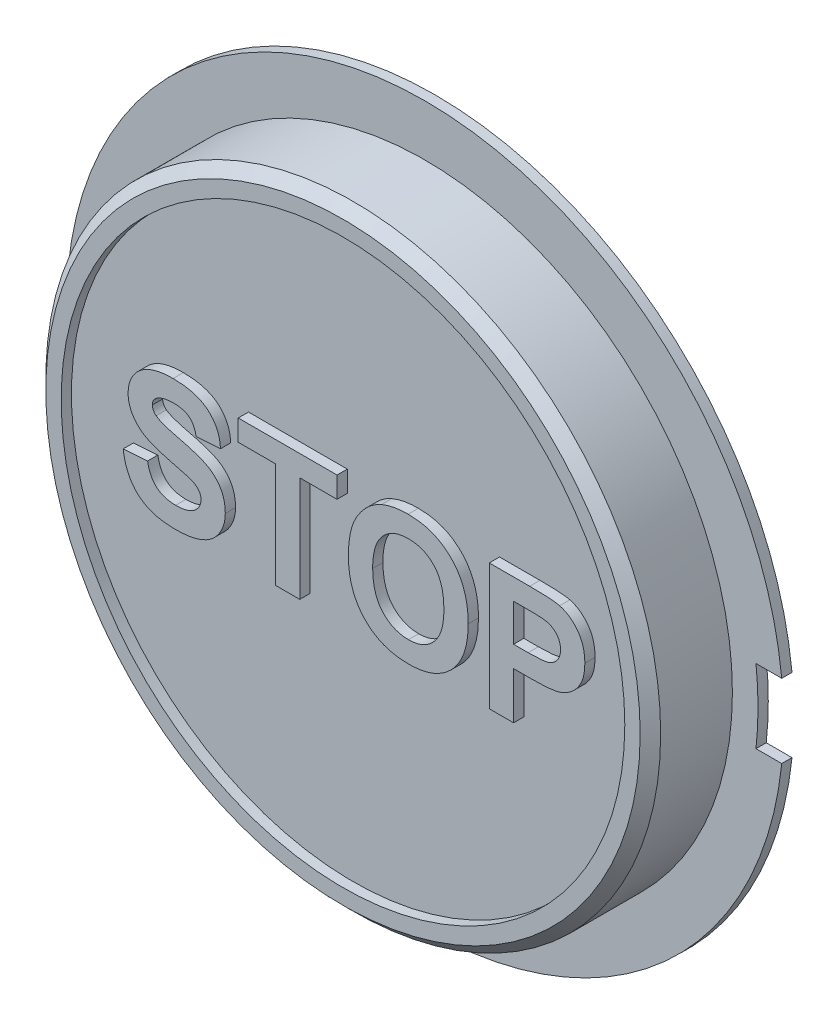
from build123d import *

# Parameters (mm, degrees)
ESQUISSE1_R        = 30
BOSS_EXTRU_1_DEPTH = 7
ESQUISSE2_R        = 30
ESQUISSE2_R_2      = 27.5
BOSS_EXTRU_3_DEPTH = 1
BOSS_EXTRU_4_DEPTH = 1
BOSS_EXTRU_5_DEPTH = 1
ESQUISSE5_R        = 28.5
ESQUISSE5_R_2      = 19
BOSS_EXTRU_6_DEPTH = 1.75
CHANFREIN1_SIZE    = 1.75
CHANFREIN2_SIZE    = 1


with BuildPart() as part:
    # Esquisse1 → Boss.-Extru.1 (new body)
    with BuildSketch(Plane.XY):
        Circle(ESQUISSE1_R)
    extrude(amount=BOSS_EXTRU_1_DEPTH)

    # Esquisse2 → Boss.-Extru.3 (add)
    with BuildSketch(Plane.XY.offset(7)):
        Circle(ESQUISSE2_R)
        Circle(ESQUISSE2_R_2, mode=Mode.SUBTRACT)
    extrude(amount=BOSS_EXTRU_3_DEPTH)

    # Esquisse3 → Boss.-Extru.4 (add)
    # profile 1 of 4: a face of its own
    with BuildSketch(Plane.XY.offset(7)):
        with BuildLine():
            Line((-21.4448355, -1.133330037), (-19.074079791, -0.975279657))
            add(Edge.make_bspline(
                [(-19.074079791, -0.975279657), (-19.055192651, -1.074463727), (-19.018505584, -1.267122475), (-18.936993809, -1.541687493), (-18.847271904, -1.797659961), (-18.740049311, -2.032295002), (-18.622667959, -2.249929712), (-18.485484927, -2.444364204), (-18.338070449, -2.621806277), (-18.173127226, -2.775882967), (-17.993423726, -2.910825461), (-17.798063245, -3.025908916), (-17.589162683, -3.125515725), (-17.366211253, -3.207538774), (-17.126911099, -3.26876938), (-16.873346877, -3.312331326), (-16.605154929, -3.340227193), (-16.42186709, -3.344067617), (-16.327954428, -3.346035366)],
                knots=[0, 0, 0, 0, 1.204560339, 2.339781841, 3.415289417, 4.440034832, 5.416475564, 6.362424008, 7.275913008, 8.16578645, 9.05021719, 9.95355393, 10.867835453, 11.809845306, 12.784702352, 13.812224031, 14.87903166, 16, 16, 16, 16], degree=3))
            add(Edge.make_bspline(
                [(-16.327954428, -3.346035366), (-16.229105411, -3.344956929), (-16.036838981, -3.342859315), (-15.758223665, -3.316836562), (-15.497705691, -3.279556168), (-15.25758552, -3.220542179), (-15.033379141, -3.15454437), (-14.830654905, -3.064252337), (-14.646132254, -2.96011353), (-14.48028656, -2.841942966), (-14.335552866, -2.710883331), (-14.208932608, -2.574061324), (-14.098654728, -2.434432927), (-14.011858232, -2.285802042), (-13.941614992, -2.134179919), (-13.895189129, -1.975043407), (-13.86382571, -1.812046625), (-13.860229239, -1.700649434), (-13.858417231, -1.644524237)],
                knots=[0, 0, 0, 0, 1.417779877, 2.757654889, 4.012140507, 5.189587551, 6.302846416, 7.360586765, 8.365575446, 9.33904572, 10.275781718, 11.161696098, 12.012180333, 12.822428111, 13.625933072, 14.403138519, 15.195454004, 16, 16, 16, 16], degree=3))
            add(Edge.make_bspline(
                [(-13.858417231, -1.644524237), (-13.860639505, -1.574203919), (-13.864987058, -1.436632507), (-13.917327247, -1.239959104), (-13.995819788, -1.057746879), (-14.114002431, -0.892687107), (-14.272868993, -0.741846533), (-14.475519124, -0.600738867), (-14.727609487, -0.473797155), (-14.914627744, -0.402988832), (-15.014160639, -0.365303969)],
                knots=[0, 0, 0, 0, 0.90494901, 1.770400303, 2.607161909, 3.452839393, 4.36912122, 5.420987164, 6.627424851, 8, 8, 8, 8], degree=3))
            add(Edge.make_bspline(
                [(-15.014160639, -0.365303969), (-15.056867569, -0.35099268), (-15.152438741, -0.318966339), (-15.315473014, -0.273171692), (-15.511852129, -0.215986344), (-15.744413884, -0.150986068), (-16.013080083, -0.084507896), (-16.314850078, -0.002614332), (-16.653402777, 0.078876459), (-16.890254653, 0.139032941), (-17.014485769, 0.170585603)],
                knots=[0, 0, 0, 0, 0.521821638, 1.167752076, 1.961721917, 2.891982557, 3.96540661, 5.168436773, 6.514817513, 8, 8, 8, 8], degree=3))
            add(Edge.make_bspline(
                [(-17.014485769, 0.170585603), (-17.176271552, 0.210979737), (-17.488410764, 0.288913614), (-17.933592757, 0.427552458), (-18.343613515, 0.565297826), (-18.714525202, 0.714758942), (-19.050419126, 0.865806424), (-19.345862103, 1.029044805), (-19.60701938, 1.195996537), (-19.759201787, 1.320780341), (-19.83222771, 1.380658829)],
                knots=[0, 0, 0, 0, 1.293880989, 2.496331788, 3.617634808, 4.64976062, 5.598842568, 6.473791081, 7.267636666, 8, 8, 8, 8], degree=3))
            add(Edge.make_bspline(
                [(-19.83222771, 1.380658829), (-19.922789347, 1.4654513), (-20.100343811, 1.631694781), (-20.334066705, 1.904864726), (-20.530457578, 2.193425065), (-20.692108767, 2.49524584), (-20.816577125, 2.81206462), (-20.904798697, 3.14176075), (-20.961898903, 3.485194704), (-20.967725586, 3.719081362), (-20.970684358, 3.83784834)],
                knots=[0, 0, 0, 0, 1.064429417, 2.086912298, 3.078678339, 4.055528992, 5.020032834, 5.993708893, 6.981211098, 8, 8, 8, 8], degree=3))
            add(Edge.make_bspline(
                [(-20.970684358, 3.83784834), (-20.964922125, 3.991531393), (-20.953491573, 4.296392695), (-20.848665966, 4.744497194), (-20.685376312, 5.176883523), (-20.495999033, 5.520214279), (-20.314048327, 5.779945296), (-20.162951511, 5.966325895), (-19.996957062, 6.14076022), (-19.813791206, 6.298993263), (-19.620255347, 6.45029364), (-19.408851159, 6.584650188), (-19.185572593, 6.711206622), (-18.862463068, 6.861233387), (-18.423768995, 7.017576013), (-17.853004436, 7.149362924), (-17.231554853, 7.22858388), (-16.800701945, 7.238302616), (-16.577377685, 7.243340135)],
                knots=[0, 0, 0, 0, 1.180131776, 2.341029169, 3.518901375, 4.725685298, 5.343762192, 5.955650671, 6.568945152, 7.192346361, 7.815201106, 8.455999361, 9.116257477, 9.787318263, 11.192748436, 12.688084276, 14.283332633, 16, 16, 16, 16], degree=3))
            add(Edge.make_bspline(
                [(-16.577377685, 7.243340135), (-16.394519591, 7.240894863), (-16.03886451, 7.236138863), (-15.523301156, 7.188045432), (-15.041737011, 7.113193694), (-14.595861939, 7.005744374), (-14.185468194, 6.863775618), (-13.808964971, 6.694663988), (-13.466672204, 6.493886047), (-13.162756972, 6.260289604), (-12.891997629, 6.002764508), (-12.655803406, 5.721472361), (-12.453271282, 5.41996571), (-12.283094141, 5.098464896), (-12.149454481, 4.755316934), (-12.051301427, 4.390950004), (-11.986382145, 4.006221737), (-11.97010993, 3.742602085), (-11.961812664, 3.608181381)],
                knots=[0, 0, 0, 0, 1.325124071, 2.577337985, 3.749592149, 4.855247722, 5.896868755, 6.892903601, 7.842551483, 8.766257401, 9.665194363, 10.546067736, 11.423174165, 12.293291263, 13.177512979, 14.086532529, 15.024315359, 16, 16, 16, 16], degree=3))
            Line((-11.961812664, 3.608181381), (-14.332568373, 3.450131))
            add(Edge.make_bspline(
                [(-14.332568373, 3.450131), (-14.346244664, 3.524471541), (-14.372898332, 3.669353523), (-14.430850708, 3.876853958), (-14.496218175, 4.068768192), (-14.572727408, 4.245094995), (-14.665141318, 4.402676187), (-14.76571421, 4.546469354), (-14.87722043, 4.674558534), (-15.003351995, 4.783436233), (-15.139774482, 4.882510478), (-15.295248037, 4.961920777), (-15.46325815, 5.035596056), (-15.650196583, 5.090981799), (-15.852473441, 5.13491576), (-16.070206548, 5.167485543), (-16.303847235, 5.183387944), (-16.464583416, 5.186879016), (-16.547743238, 5.188685187)],
                knots=[0, 0, 0, 0, 1.151066407, 2.24330871, 3.278475654, 4.238599069, 5.165719782, 6.056502506, 6.909492653, 7.744782051, 8.590364415, 9.471203867, 10.39832458, 11.382154319, 12.435022857, 13.550631277, 14.73277401, 16, 16, 16, 16], degree=3))
            add(Edge.make_bspline(
                [(-16.547743238, 5.188685187), (-16.634206743, 5.187090636), (-16.802425354, 5.183988365), (-17.047564706, 5.164950185), (-17.277523811, 5.129807538), (-17.493432062, 5.08406053), (-17.695001057, 5.021824889), (-17.881805424, 4.945938719), (-18.054699808, 4.856597337), (-18.160123265, 4.786306622), (-18.212211309, 4.751577103)],
                knots=[0, 0, 0, 0, 1.186678824, 2.308736671, 3.37120409, 4.377216403, 5.334874112, 6.262130804, 7.141346615, 8, 8, 8, 8], degree=3))
            add(Edge.make_bspline(
                [(-18.212211309, 4.751577103), (-18.271821702, 4.704135594), (-18.387268531, 4.612256116), (-18.511513748, 4.429814713), (-18.586309656, 4.223752618), (-18.595312192, 4.078032109), (-18.599928649, 4.003307332)],
                knots=[0, 0, 0, 0, 1.037857257, 2.010007357, 2.979541333, 4, 4, 4, 4], degree=3))
            add(Edge.make_bspline(
                [(-18.599928649, 4.003307332), (-18.596153229, 3.933472067), (-18.588716251, 3.795907708), (-18.513704758, 3.60049456), (-18.398347301, 3.419430221), (-18.290564678, 3.3210737), (-18.234437144, 3.269854785)],
                knots=[0, 0, 0, 0, 0.98538058, 1.941042925, 2.927803204, 4, 4, 4, 4], degree=3))
            add(Edge.make_bspline(
                [(-18.234437144, 3.269854785), (-18.189892714, 3.236611139), (-18.090354453, 3.162325429), (-17.90802009, 3.067901263), (-17.687937728, 2.965634188), (-17.425090023, 2.86565683), (-17.121223853, 2.765865057), (-16.776320739, 2.661670909), (-16.390168552, 2.556077857), (-15.97261012, 2.453816159), (-15.548670709, 2.353298783), (-15.144117009, 2.243404922), (-14.767940245, 2.136266905), (-14.421884642, 2.023968879), (-14.104166347, 1.914647097), (-13.816328722, 1.802365755), (-13.556395363, 1.693016291), (-13.25328425, 1.542653032), (-12.90973829, 1.338979921), (-12.549663368, 1.042907088), (-12.231223048, 0.710101886), (-12.009342296, 0.396289537), (-11.85692183, 0.126402566), (-11.758779132, -0.088728775), (-11.673877999, -0.315422963), (-11.604768709, -0.553930512), (-11.554681103, -0.80458703), (-11.513230693, -1.0654775), (-11.492052911, -1.338768675), (-11.489141073, -1.525133809), (-11.487661522, -1.619828865)],
                knots=[0, 0, 0, 0, 0.511875881, 1.143829537, 1.88775736, 2.750598373, 3.734912702, 4.837306479, 6.073130119, 7.42648979, 8.801963576, 10.091065733, 11.292408984, 12.408830014, 13.446061236, 14.39066453, 15.257936293, 16.045629259, 17.510392066, 18.929669597, 20.331293837, 21.746891395, 22.460690638, 23.187651344, 23.925159671, 24.69163991, 25.474819891, 26.281170188, 27.126635539, 28, 28, 28, 28], degree=3))
            add(Edge.make_bspline(
                [(-11.487661522, -1.619828865), (-11.489695952, -1.707158878), (-11.493736132, -1.880587824), (-11.521970009, -2.138000161), (-11.565632992, -2.390841331), (-11.630269207, -2.639428301), (-11.716015742, -2.883272048), (-11.812559528, -3.125891912), (-11.933282096, -3.361996863), (-12.070680844, -3.591782454), (-12.222237905, -3.815076246), (-12.393980206, -4.021059684), (-12.575820275, -4.21660487), (-12.779377208, -4.390762366), (-12.992080908, -4.5576338), (-13.223660222, -4.705417946), (-13.468689585, -4.839149516), (-13.728718274, -4.957830065), (-14.004668236, -5.061249436), (-14.296181066, -5.153299866), (-14.605883122, -5.228636074), (-14.931191931, -5.293208694), (-15.273297975, -5.342314503), (-15.63177355, -5.376601776), (-16.006700147, -5.395937731), (-16.262078557, -5.399086436), (-16.392162395, -5.400690314)],
                knots=[0, 0, 0, 0, 0.900570041, 1.788444861, 2.667795364, 3.545012114, 4.433698372, 5.332345486, 6.235991676, 7.164928091, 8.092777575, 9.015680987, 9.928493428, 10.842962589, 11.775229507, 12.714851019, 13.672254427, 14.652424454, 15.660007982, 16.709910502, 17.803296389, 18.945495772, 20.129342395, 21.366102753, 22.658353839, 24, 24, 24, 24], degree=3))
            add(Edge.make_bspline(
                [(-16.392162395, -5.400690314), (-16.579983386, -5.397623817), (-16.945675311, -5.391653274), (-17.476959998, -5.338212221), (-17.975269864, -5.256416835), (-18.439793698, -5.137704138), (-18.87109926, -4.985303831), (-19.268989835, -4.797580304), (-19.631540876, -4.573412009), (-19.963242768, -4.318235403), (-20.259676105, -4.027400525), (-20.526229559, -3.706933366), (-20.759307248, -3.353948173), (-20.958755973, -2.968997059), (-21.12961814, -2.554161067), (-21.270529815, -2.10924971), (-21.3766289, -1.632141001), (-21.421706756, -1.302476002), (-21.4448355, -1.133330037)],
                knots=[0, 0, 0, 0, 1.217954099, 2.371385517, 3.459848295, 4.490682126, 5.476952527, 6.422732854, 7.338496285, 8.236688651, 9.131557988, 10.026443255, 10.935708282, 11.869506048, 12.834296687, 13.842423496, 14.892981177, 16, 16, 16, 16], degree=3))
        make_face()
    # profile 2 of 4: a face of its own
    with BuildSketch(Plane.XY.offset(7)):
        Polygon((-6.588099723, -5.242639933), (-6.588099723, 5.030634806), (-10.223258477, 5.030634806), (-10.223258477, 7.085289754), (-0.58218526, 7.085289754), (-0.58218526, 5.030634806), (-4.217344014, 5.030634806), (-4.217344014, -5.242639933), align=None)
    # profile 3 of 4: a face of its own
    with BuildSketch(Plane.XY.offset(7)):
        with BuildLine():
            add(Edge.make_bspline(
                [(0.524167405, 0.847238795), (0.525039802, 0.999582262), (0.526753077, 1.298765167), (0.556440166, 1.73767772), (0.595570062, 2.15839179), (0.659293035, 2.559252554), (0.734254516, 2.942136177), (0.828011433, 3.306929007), (0.940955317, 3.652351726), (1.030803071, 3.872900398), (1.0748742, 3.981081498)],
                knots=[0, 0, 0, 0, 1.141009212, 2.240794809, 3.294380675, 4.305229195, 5.280013876, 6.216333343, 7.125095522, 8, 8, 8, 8], degree=3))
            add(Edge.make_bspline(
                [(1.0748742, 3.981081498), (1.146913769, 4.134873462), (1.290145605, 4.440648545), (1.556149637, 4.87273332), (1.857649522, 5.280224272), (2.192163096, 5.660985166), (2.551150121, 6.009283861), (2.936304132, 6.307377393), (3.333941761, 6.565333014), (3.61675239, 6.695069359), (3.756791595, 6.759310844)],
                knots=[0, 0, 0, 0, 1.031372299, 2.050613973, 3.077158538, 4.108712802, 5.127684358, 6.111366908, 7.06480644, 8, 8, 8, 8], degree=3))
            add(Edge.make_bspline(
                [(3.756791595, 6.759310844), (3.851849684, 6.798301551), (4.043986318, 6.877111711), (4.342589264, 6.975470921), (4.652522049, 7.055383332), (4.971542951, 7.126815718), (5.302749396, 7.176070698), (5.643465097, 7.217369305), (5.995554675, 7.239014624), (6.233712531, 7.241882617), (6.354744727, 7.243340135)],
                knots=[0, 0, 0, 0, 0.92659354, 1.872881803, 2.832850937, 3.813025581, 4.820167273, 5.851730198, 6.908245912, 8, 8, 8, 8], degree=3))
            add(Edge.make_bspline(
                [(6.354744727, 7.243340135), (6.571462247, 7.237907738), (6.995581412, 7.227276463), (7.615100413, 7.150488029), (8.201353489, 7.02082369), (8.752356163, 6.833410658), (9.27285901, 6.5991403), (9.758818032, 6.308554599), (10.210952459, 5.96479858), (10.628389017, 5.572586243), (11.004320536, 5.132601114), (11.331725659, 4.648953311), (11.606374292, 4.123909253), (11.8325633, 3.558917559), (12.006372508, 2.952132789), (12.131949499, 2.305267046), (12.206552398, 1.617843861), (12.215368069, 1.146241107), (12.21989557, 0.90403815)],
                knots=[0, 0, 0, 0, 1.064641025, 2.083517118, 3.061799897, 4.009540929, 4.938075217, 5.861300345, 6.78508344, 7.723570974, 8.670267188, 9.622657076, 10.586935816, 11.576069104, 12.607749008, 13.683335114, 14.81022093, 16, 16, 16, 16], degree=3))
            add(Edge.make_bspline(
                [(12.21989557, 0.90403815), (12.215472641, 0.663457018), (12.206862025, 0.195090501), (12.130866617, -0.486938445), (12.010495862, -1.129088518), (11.832481164, -1.729892814), (11.613042949, -2.293935871), (11.335568113, -2.814499486), (11.015019841, -3.298488593), (10.639622263, -3.733732537), (10.2292114, -4.128195783), (9.777650482, -4.467934158), (9.295229003, -4.758913587), (8.777564035, -4.993860949), (8.228029624, -5.177414276), (7.644832401, -5.308074991), (7.027673258, -5.384567933), (6.605206594, -5.395237809), (6.389318247, -5.400690314)],
                knots=[0, 0, 0, 0, 1.18845052, 2.313691126, 3.386664782, 4.412527756, 5.405809582, 6.372003093, 7.321919452, 8.268293321, 9.206237639, 10.129603466, 11.054616372, 11.9847576, 12.932764752, 13.912672021, 14.933336461, 16, 16, 16, 16], degree=3))
            add(Edge.make_bspline(
                [(6.389318247, -5.400690314), (6.170963889, -5.395225226), (5.743581681, -5.38452848), (5.119839961, -5.308268377), (4.530853513, -5.177564651), (3.977041748, -4.993365673), (3.454627568, -4.761987447), (2.968434222, -4.473981407), (2.518192954, -4.132091407), (2.104352867, -3.74227134), (1.729187412, -3.308307019), (1.409094278, -2.827429828), (1.131604969, -2.311950819), (0.911013056, -1.75406172), (0.73397862, -1.159502494), (0.61331373, -0.524852001), (0.537171373, 0.148143034), (0.52858129, 0.609947509), (0.524167405, 0.847238795)],
                knots=[0, 0, 0, 0, 1.080878253, 2.11558926, 3.1052859, 4.062802436, 5.000434901, 5.928596448, 6.853693179, 7.793554778, 8.738606028, 9.68692032, 10.647726704, 11.63151566, 12.651483354, 13.714466703, 14.825613081, 16, 16, 16, 16], degree=3))
        make_face()
        with BuildLine():
            add(Edge.make_bspline(
                [(2.894923114, 0.928733522), (2.897291469, 0.758205685), (2.901877744, 0.427981774), (2.950727645, -0.051330241), (3.0248613, -0.499419755), (3.133885728, -0.915778195), (3.271617343, -1.300706768), (3.440367123, -1.65452746), (3.639437692, -1.977767253), (3.873978022, -2.263602097), (4.127732268, -2.518797517), (4.401637339, -2.739605917), (4.690588608, -2.929657052), (4.999585807, -3.079701781), (5.322198154, -3.198778689), (5.66093212, -3.287069856), (6.017471972, -3.335550377), (6.26076487, -3.34250288), (6.384379173, -3.346035366)],
                knots=[0, 0, 0, 0, 1.313550922, 2.543666373, 3.708465049, 4.810029406, 5.85539231, 6.85404609, 7.825601258, 8.772642133, 9.696587791, 10.59409323, 11.479048685, 12.35559886, 13.234601248, 14.125357077, 15.047515647, 16, 16, 16, 16], degree=3))
            add(Edge.make_bspline(
                [(6.384379173, -3.346035366), (6.508010129, -3.342574453), (6.751335803, -3.335762819), (7.107437575, -3.286291048), (7.446842822, -3.201784228), (7.768173525, -3.08331752), (8.072894266, -2.930890264), (8.360739629, -2.745099676), (8.630050403, -2.523286694), (8.883528442, -2.271798625), (9.111737964, -1.984065296), (9.309113609, -1.660881285), (9.477780247, -1.30491466), (9.615526366, -0.916032253), (9.72186768, -0.493502388), (9.79297576, -0.037101502), (9.842220683, 0.451865413), (9.846788253, 0.789484369), (9.849139861, 0.963307043)],
                knots=[0, 0, 0, 0, 0.949153107, 1.868086493, 2.754172764, 3.630100905, 4.492260106, 5.365378617, 6.254840125, 7.166615376, 8.102436631, 9.067266169, 10.06813181, 11.121736829, 12.23011542, 13.408501285, 14.665770308, 16, 16, 16, 16], degree=3))
            add(Edge.make_bspline(
                [(9.849139861, 0.963307043), (9.84648369, 1.135451366), (9.841339764, 1.468825205), (9.796541478, 1.951619373), (9.723170164, 2.400785296), (9.62117593, 2.816206615), (9.486384141, 3.19795027), (9.325391125, 3.547060176), (9.130727701, 3.861712428), (8.907472606, 4.141744104), (8.660430564, 4.388225969), (8.393798734, 4.604010282), (8.10606221, 4.783555948), (7.800029252, 4.934619268), (7.47251374, 5.046692594), (7.126843997, 5.128437932), (6.762041802, 5.178776838), (6.512134067, 5.185333412), (6.384379173, 5.188685187)],
                knots=[0, 0, 0, 0, 1.332337092, 2.580197383, 3.749299508, 4.852775005, 5.886662144, 6.878700295, 7.822989687, 8.743523536, 9.644687758, 10.519443927, 11.392806431, 12.264866173, 13.155606721, 14.065961015, 15.011303331, 16, 16, 16, 16], degree=3))
            add(Edge.make_bspline(
                [(6.384379173, 5.188685187), (6.256608132, 5.185384969), (6.006668809, 5.178929248), (5.641297971, 5.127756911), (5.294539257, 5.048447375), (4.967070036, 4.929974648), (4.658371435, 4.780362016), (4.369585244, 4.594812531), (4.098435919, 4.379394422), (3.849180452, 4.129175326), (3.622307922, 3.846691449), (3.427550754, 3.528194467), (3.26147748, 3.177162763), (3.125223986, 2.792557253), (3.024218014, 2.373319909), (2.946586517, 1.922268263), (2.902991547, 1.436672284), (2.897670396, 1.101685431), (2.894923114, 0.928733522)],
                knots=[0, 0, 0, 0, 0.981996942, 1.920933313, 2.83127778, 3.712125466, 4.592427284, 5.463259035, 6.34592384, 7.249932058, 8.173122297, 9.125107726, 10.113123258, 11.154048744, 12.256187849, 13.424658091, 14.670364834, 16, 16, 16, 16], degree=3))
        make_face(mode=Mode.SUBTRACT)
    # profile 4 of 4: a face of its own
    with BuildSketch(Plane.XY.offset(7)):
        with BuildLine():
            Line((14.274550518, -5.242639933), (14.274550518, 7.085289754))
            Line((14.274550518, 7.085289754), (18.218401421, 7.085289754))
            add(Edge.make_bspline(
                [(18.218401421, 7.085289754), (18.397037117, 7.085094676), (18.738699123, 7.084721564), (19.226059307, 7.074354976), (19.664854139, 7.059679928), (20.054432375, 7.041402776), (20.396164841, 7.014129756), (20.688518561, 6.982548008), (20.933334469, 6.948574429), (21.077499305, 6.913416318), (21.142333462, 6.897604927)],
                knots=[0, 0, 0, 0, 1.460485487, 2.793352117, 3.985295279, 5.050041172, 5.981765236, 6.787433016, 7.454681457, 8, 8, 8, 8], degree=3))
            add(Edge.make_bspline(
                [(21.142333462, 6.897604927), (21.228547125, 6.87302209), (21.399661047, 6.824230916), (21.644813938, 6.720215885), (21.881102504, 6.599668014), (22.105558034, 6.45599674), (22.318943521, 6.291752738), (22.521893246, 6.108275437), (22.715489511, 5.904736583), (22.897054159, 5.681538255), (23.063346018, 5.439805935), (23.207063965, 5.179182227), (23.327469555, 4.900799936), (23.430053117, 4.606751069), (23.505739758, 4.293882945), (23.558706646, 3.96436941), (23.595578209, 3.618066339), (23.59818883, 3.381084761), (23.599522973, 3.259976636)],
                knots=[0, 0, 0, 0, 0.907145743, 1.80047177, 2.69161667, 3.591261238, 4.495029544, 5.415863088, 6.359363025, 7.337192411, 8.326890979, 9.326929023, 10.346104993, 11.395420813, 12.477187422, 13.601053412, 14.774031606, 16, 16, 16, 16], degree=3))
            add(Edge.make_bspline(
                [(23.599522973, 3.259976636), (23.595718004, 3.076060179), (23.588393228, 2.7220109), (23.506441983, 2.214438346), (23.381446174, 1.750803539), (23.198755768, 1.335572244), (22.976018212, 0.967115025), (22.730668207, 0.634952581), (22.450514558, 0.349096627), (22.147833254, 0.104933972), (21.827954435, -0.094878616), (21.50749657, -0.26521601), (21.182135548, -0.396176841), (20.960305128, -0.453237528), (20.850928073, -0.481372217)],
                knots=[0, 0, 0, 0, 1.312386234, 2.526415563, 3.661883817, 4.733421185, 5.753802465, 6.732107337, 7.675884281, 8.604170108, 9.50284679, 10.365392406, 11.194030444, 12, 12, 12, 12], degree=3))
            add(Edge.make_bspline(
                [(20.850928073, -0.481372217), (20.772860095, -0.496222582), (20.608302113, -0.527525377), (20.347322997, -0.558728567), (20.062058679, -0.593267096), (19.751335848, -0.615795065), (19.415530397, -0.636891564), (19.054772721, -0.646851918), (18.669578381, -0.658852121), (18.404451779, -0.65906775), (18.267792165, -0.659178896)],
                knots=[0, 0, 0, 0, 0.735353946, 1.55003838, 2.431865514, 3.394945452, 4.432993119, 5.54609699, 6.735134699, 8, 8, 8, 8], degree=3))
            Line((18.267792165, -0.659178896), (16.645306227, -0.659178896))
            Line((16.645306227, -0.659178896), (16.645306227, -5.242639933))
            Line((16.645306227, -5.242639933), (14.274550518, -5.242639933))
        make_face()
        with BuildLine():
            Line((16.645306227, 5.030634806), (16.645306227, 1.395476052))
            Line((16.645306227, 1.395476052), (18.067759652, 1.395476052))
            add(Edge.make_bspline(
                [(18.067759652, 1.395476052), (18.190424106, 1.395634892), (18.42509664, 1.395938773), (18.761799669, 1.406846323), (19.06658357, 1.420161011), (19.340085179, 1.442199543), (19.580653566, 1.471245802), (19.789899761, 1.505988785), (19.968067633, 1.543271636), (20.160731932, 1.605055295), (20.366728587, 1.705015621), (20.586708806, 1.848683717), (20.779961169, 2.020455869), (20.940772749, 2.222196314), (21.069225598, 2.446341637), (21.161197931, 2.690594723), (21.220584381, 2.950907443), (21.226008792, 3.131232811), (21.228767264, 3.222933578)],
                knots=[0, 0, 0, 0, 1.411705958, 2.700771114, 3.876961699, 4.922619712, 5.858038221, 6.66485904, 7.363650596, 7.950905807, 8.989198271, 9.987739806, 10.967313358, 11.951275539, 12.944273208, 13.927870418, 14.946261014, 16, 16, 16, 16], degree=3))
            add(Edge.make_bspline(
                [(21.228767264, 3.222933578), (21.224885016, 3.33462368), (21.21735785, 3.551176061), (21.134354212, 3.859582793), (21.006289084, 4.139465641), (20.82319231, 4.382116186), (20.602015716, 4.586165341), (20.353422455, 4.755941491), (20.072103706, 4.874752134), (19.873005435, 4.920786873), (19.771740318, 4.944201004)],
                knots=[0, 0, 0, 0, 1.085904563, 2.105425768, 3.088705091, 4.068969419, 5.045188284, 6.010769642, 6.988240112, 8, 8, 8, 8], degree=3))
            add(Edge.make_bspline(
                [(19.771740318, 4.944201004), (19.728163625, 4.951170741), (19.631436877, 4.966641396), (19.470657336, 4.982786948), (19.280455114, 4.997471312), (19.060600941, 5.009527613), (18.811966263, 5.018952849), (18.533730972, 5.02721168), (18.226627853, 5.027875167), (18.011781465, 5.02968944), (17.899831123, 5.030634806)],
                knots=[0, 0, 0, 0, 0.564603001, 1.253243608, 2.066786758, 3.005752288, 4.070476343, 5.250658742, 6.567396469, 8, 8, 8, 8], degree=3))
            Line((17.899831123, 5.030634806), (16.645306227, 5.030634806))
        make_face(mode=Mode.SUBTRACT)
    extrude(amount=BOSS_EXTRU_4_DEPTH)

    # Esquisse4 → Boss.-Extru.5 (add)
    with BuildSketch(Plane(origin=(0, 0, 0), x_dir=(-1, 0, 0), z_dir=(0, 0, -1))):
        with BuildLine():
            Line((-32.3, 3.6), (-34.814364851, 3.6))
            ThreePointArc((-34.814364851, 3.6), (0, 35), (34.814364851, 3.6))
            Line((34.814364851, 3.6), (32.3, 3.6))
            ThreePointArc((32.3, 3.6), (32.5, 0), (32.3, -3.6))
            Line((32.3, -3.6), (34.814364851, -3.6))
            ThreePointArc((34.814364851, -3.6), (0, -35), (-34.814364851, -3.6))
            Line((-34.814364851, -3.6), (-32.3, -3.6))
            ThreePointArc((-32.3, -3.6), (-32.5, 0), (-32.3, 3.6))
        make_face()
    extrude(amount=BOSS_EXTRU_5_DEPTH)

    # Esquisse5 → Boss.-Extru.6 (add)
    with BuildSketch(Plane(origin=(0, 0, -1), x_dir=(-1, 0, 0), z_dir=(0, 0, -1))):
        Circle(ESQUISSE5_R)
        Circle(ESQUISSE5_R_2, mode=Mode.SUBTRACT)
    extrude(amount=BOSS_EXTRU_6_DEPTH)

    # Chanfrein1
    chanfrein1_edges = [part.edges().sort_by_distance(p)[0] for p in [
        (19, 0, -1),
    ]]
    chamfer(chanfrein1_edges, length=CHANFREIN1_SIZE - 0.0001)  # a hair under: the kernel refuses the full size

    # Chanfrein2
    chanfrein2_edges = [part.edges().sort_by_distance(p)[0] for p in [
        (-30, 0, 8),
    ]]
    chamfer(chanfrein2_edges, length=CHANFREIN2_SIZE)


solid = part.part
